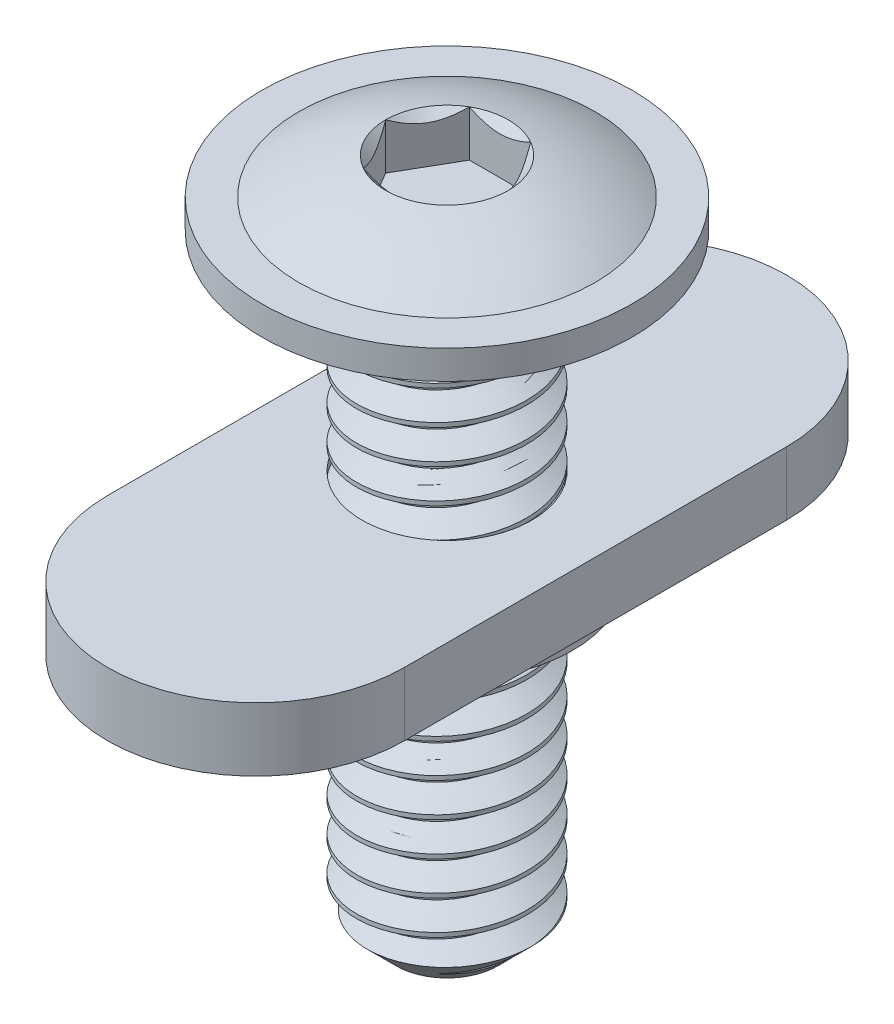
from build123d import *

# Parameters (mm, degrees)
SKETCH2_W                    = 3.175
SKETCH2_H                    = 22.86
CHAMFER1_SIZE                = 1.27
CUT_SWEEP1_PITCH             = 1.27
CUT_EXTRUDE1_DEPTH           = 1.984375
SKETCH7_R                    = 2.291358881
CUT_EXTRUDE2_DEPTH           = 1.726209
CUT_EXTRUDE2_TAPER           = 45
CUT_EXTRUDE2_OTHER_WAY_DEPTH = 28.122178876
SKETCH8_R                    = 3.175
EXTRUDE1_DEPTH               = 1.7272
SKETCH9_R                    = 4.699
CUT_EXTRUDE3_DEPTH           = 1.0795


with BuildPart() as part:
    # Sketch2 → Revolve2 (revolve)
    with BuildSketch(Plane.XY, mode=Mode.PRIVATE) as revolve2_sk:
        with Locations((-1.5875, 1.27)):
            Rectangle(SKETCH2_W, SKETCH2_H)
    revolve(revolve2_sk.sketch.rotate(Axis((0, 0, 0), (0, 1, 0)), 270), axis=Axis((0, 0, 0), (0, 1, 0)))

    # Chamfer1
    chamfer1_edges = [part.edges().sort_by_distance(p)[0] for p in [
        (0, -10.16, 3.175),
    ]]
    chamfer(chamfer1_edges, length=CHAMFER1_SIZE)

    # Cut-Sweep1: the profile of Sketch4 profile screwed along a right-hand helix of 20 turns, 6 arcs to a turn; built about Z, then put on its axis
    cut_sweep1_z = Axis((0, 0, 0), (0, 0, 1))
    cut_sweep1_corners = [(3.1753, 0, -1.111423205), (3.1753, 0, 0.000173205), (2.350110803, 0, -0.47625), (2.350110803, 0, -0.635)]
    with BuildLine(mode=Mode.PRIVATE) as cut_sweep1_profile:
        Line(cut_sweep1_corners[0], cut_sweep1_corners[1])
        Line(cut_sweep1_corners[1], cut_sweep1_corners[2])
        Line(cut_sweep1_corners[2], cut_sweep1_corners[3])
        Line(cut_sweep1_corners[3], cut_sweep1_corners[0])
    cut_sweep1_cap = Face(cut_sweep1_profile.wire())
    cut_sweep1_turn_angles = [0, 30, 60, 90, 120, 150, 180, 210, 240, 270, 300, 330, 360]
    cut_sweep1_turn_weights = [1, 0.8660254037844387, 1, 0.8660254037844387, 1, 0.8660254037844387, 1, 0.8660254037844387, 1, 0.8660254037844387, 1, 0.8660254037844387, 1]
    cut_sweep1_turn_rails = [Edge.make_bspline([Vector(p[0], p[1], 0).rotate(cut_sweep1_z, cut_sweep1_turn_angles[k]) / cut_sweep1_turn_weights[k] + Vector(0, 0, p[2] + CUT_SWEEP1_PITCH * cut_sweep1_turn_angles[k] / 360) for k in range(13)], [0, 0, 0, 1, 1, 2, 2, 3, 3, 4, 4, 5, 5, 6, 6, 6], 2, cut_sweep1_turn_weights) for p in cut_sweep1_corners]
    cut_sweep1_turn_sides = [Face.make_surface_from_curves(cut_sweep1_turn_rails[p[0]], cut_sweep1_turn_rails[p[1]]) for p in [(0, 1), (1, 2), (2, 3), (3, 0)]]
    cut_sweep1 = Plane(origin=(0, 12.7, 0), x_dir=(1, 0, 0), z_dir=(0, -1, 0)) * Solid(Shell([*[p.moved(Location((0, 0, CUT_SWEEP1_PITCH * i))) for i in range(20) for p in cut_sweep1_turn_sides], cut_sweep1_cap, cut_sweep1_cap.rotate(cut_sweep1_z, 7200).moved(Location((0, 0, CUT_SWEEP1_PITCH * 7200 / 360)))]))
    add(cut_sweep1, mode=Mode.SUBTRACT)

    # Sketch5 → Revolve3 (revolve)
    with BuildSketch(Plane.XY):
        with BuildLine():
            Line((0, 12.7), (0, 15.3924))
            ThreePointArc((0, 15.3924), (-2.884017607, 14.980293811), (-5.5372, 13.77696))
            Line((-5.5372, 13.77696), (-6.9215, 13.77696))
            Line((-6.9215, 13.77696), (-6.9215, 12.7))
            Line((-6.9215, 12.7), (0, 12.7))
        make_face()
    revolve(axis=Axis((0, 0, 0), (0, 1, 0)))

    # Sketch6 → Cut-Extrude1 (cut)
    with BuildSketch(Plane(origin=(0, 15.3924, 0), x_dir=(-1, 0, 0), z_dir=(0, 1, 0))):
        Polygon((1.14567944, 1.984375), (-1.14567944, 1.984375), (-2.291358881, 0), (-1.14567944, -1.984375), (1.14567944, -1.984375), (2.291358881, 0), align=None)
    extrude(amount=-CUT_EXTRUDE1_DEPTH, mode=Mode.SUBTRACT)

    # Sketch7 → Cut-Extrude2 (cut)
    with BuildSketch(Plane(origin=(0, 15.134233625, 0), x_dir=(-1, 0, 0), z_dir=(0, 1, 0))):
        Circle(SKETCH7_R)
    extrude(amount=-CUT_EXTRUDE2_DEPTH, taper=CUT_EXTRUDE2_TAPER, mode=Mode.SUBTRACT)

    # Sketch7 → Cut-Extrude2 other way (cut)
    with BuildSketch(Plane(origin=(0, 15.134233625, 0), x_dir=(-1, 0, 0), z_dir=(0, 1, 0))):
        Circle(SKETCH7_R)
    extrude(amount=CUT_EXTRUDE2_OTHER_WAY_DEPTH, mode=Mode.SUBTRACT)


with BuildPart() as body_2:
    # Sketch8 → Extrude1 (new, symmetric)
    with BuildSketch(Plane.XZ.offset(-3.175)):
        with BuildLine():
            Line((-5.55625, 7.14375), (-5.55625, -7.14375))
            ThreePointArc((-5.55625, -7.14375), (0, -12.7), (5.55625, -7.14375))
            Line((5.55625, -7.14375), (5.55625, 7.14375))
            ThreePointArc((5.55625, 7.14375), (0, 12.7), (-5.55625, 7.14375))
        make_face()
        with Locations(Location((0, 0, 0), (0, 0, 270))):
            Circle(SKETCH8_R, mode=Mode.SUBTRACT)
    extrude(amount=EXTRUDE1_DEPTH, both=True)

    # Sketch9 → Cut-Extrude3 (cut)
    with BuildSketch(Plane.XZ.offset(-1.4478)):
        with BuildLine():
            Line((5.55625, -7.14375), (5.55625, 7.14375))
            ThreePointArc((5.55625, 7.14375), (0, 12.7), (-5.55625, 7.14375))
            Line((-5.55625, 7.14375), (-5.55625, -7.14375))
            ThreePointArc((-5.55625, -7.14375), (0, -12.7), (5.55625, -7.14375))
        make_face()
        with Locations(Location((0, 0, 0), (0, 0, 270))):
            Circle(SKETCH9_R, mode=Mode.SUBTRACT)
    extrude(amount=-CUT_EXTRUDE3_DEPTH, mode=Mode.SUBTRACT)


solid = Compound([part.part, body_2.part])
